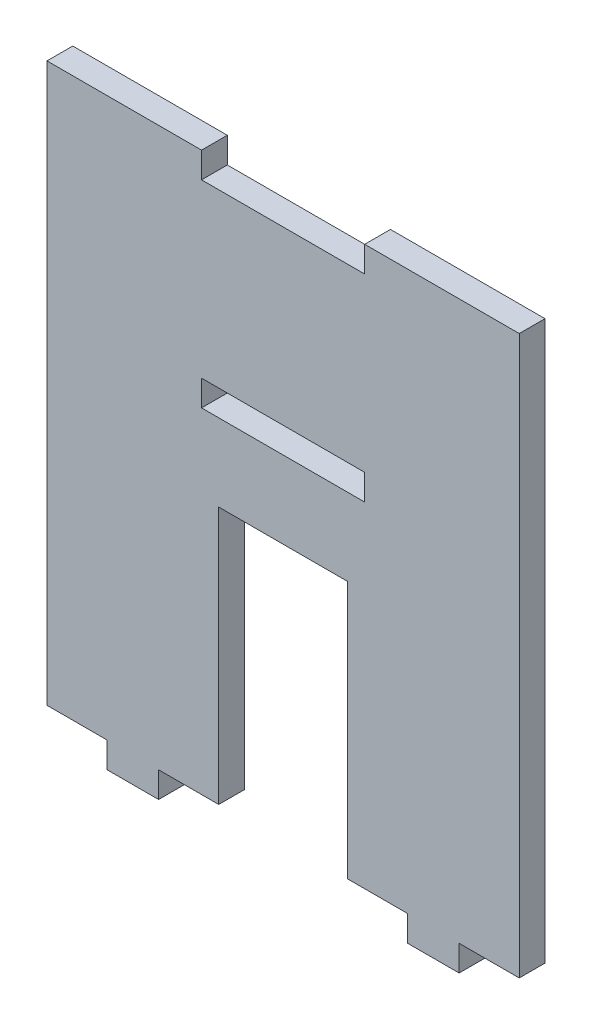
from build123d import *

# Parameters (mm, degrees)
BOSS_EXTRUDE1_DEPTH = 3


with BuildPart() as part:
    # Sketch1 → Boss-Extrude1 (new body)
    with BuildSketch(Plane.XY):
        Polygon((0, 65), (0, 0), (7, 0), (7, -3), (13, -3), (13, 0), (20, 0), (20, 30), (35, 30), (35, 0), (42, 0), (42, -3), (48, -3), (48, 0), (55, 0), (55, 65), (37, 65), (37, 62), (18, 62), (18, 65), align=None)
        Polygon((27.5, 42), (37, 42), (37, 39), (27.5, 39), (18, 39), (18, 42), align=None, mode=Mode.SUBTRACT)
    extrude(amount=BOSS_EXTRUDE1_DEPTH)


solid = part.part
